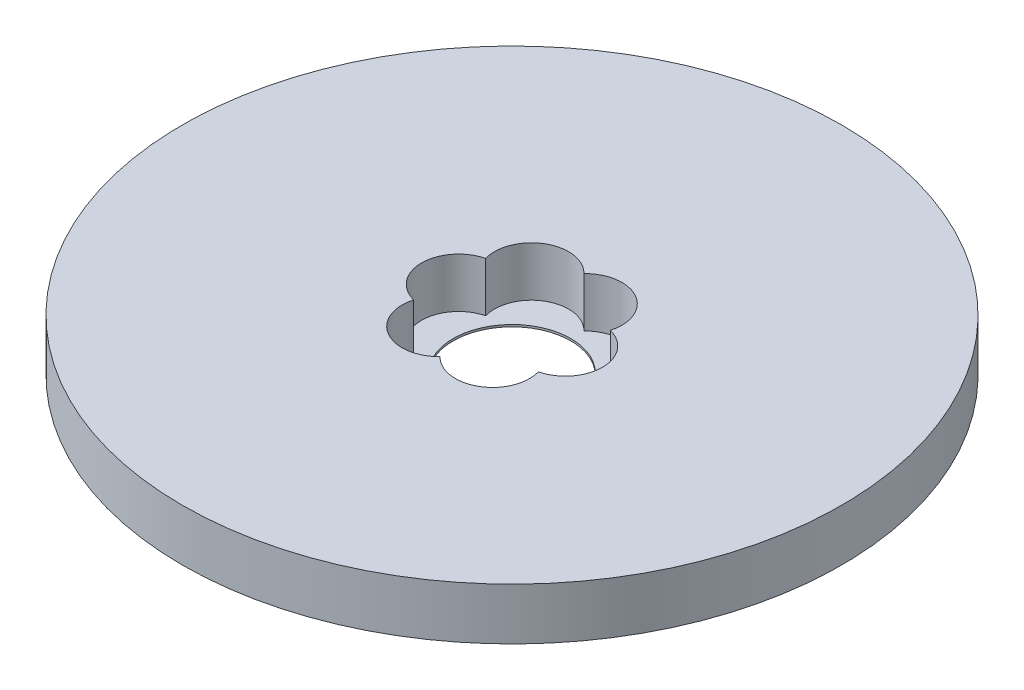
from build123d import *

# Parameters (mm, degrees)
SKETCH1_R           = 70
BOSS_EXTRUDE1_DEPTH = 11
SKETCH2_R           = 12.5
CUT_EXTRUDE1_DEPTH  = 100.604216778
SKETCH3_R           = 7.874590161
CUT_EXTRUDE2_DEPTH  = 10.562321237
CIRPATTERN1_COUNT   = 6


with BuildPart() as part:
    # Sketch1 → Boss-Extrude1 (new body)
    with BuildSketch(Plane(origin=(0, 0, 0), x_dir=(1, 0, 0), z_dir=(0, 1, 0))):
        Circle(SKETCH1_R)
    extrude(amount=BOSS_EXTRUDE1_DEPTH)

    # Sketch2 → Cut-Extrude1 (cut, through all)
    with BuildSketch(Plane(origin=(0, 0, 0), x_dir=(1, 0, 0), z_dir=(0, 1, 0))):
        Circle(SKETCH2_R)
    extrude(amount=CUT_EXTRUDE1_DEPTH, mode=Mode.SUBTRACT)

    # Sketch3 → Cut-Extrude2 (cut)
    with BuildSketch(Plane(origin=(0, 11, 0), x_dir=(1, 0, 0), z_dir=(0, 1, 0))):
        with Locations((-11.334309292, 0)):
            Circle(SKETCH3_R)
    cut_extrude2 = extrude(amount=-CUT_EXTRUDE2_DEPTH, mode=Mode.SUBTRACT)

    # CirPattern1: Cut-Extrude2 ×6 about axis
    cirpattern1_axis = Axis((0, 0, 0), (0, 1, 0))
    for i in range(1, CIRPATTERN1_COUNT):
        add(cut_extrude2.rotate(cirpattern1_axis, i * 360 / CIRPATTERN1_COUNT), mode=Mode.SUBTRACT)


solid = part.part
